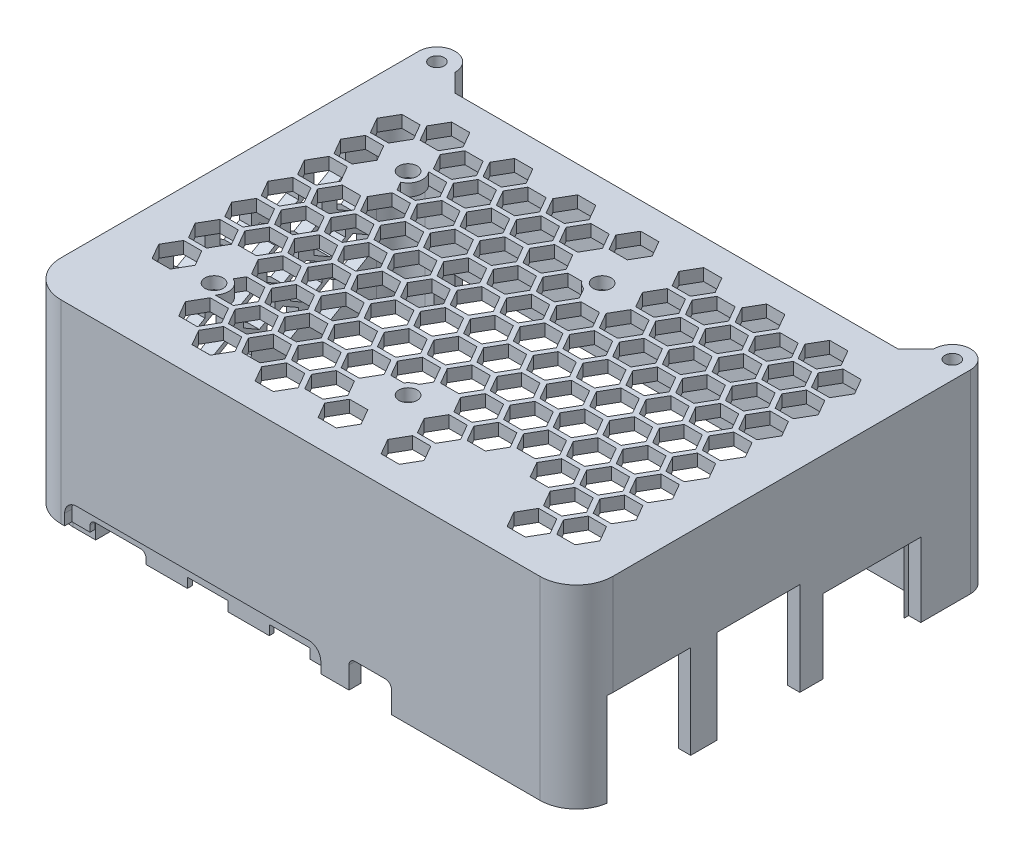
from build123d import *

# Parameters (mm, degrees)
BOSS_EXTRUDE1_DEPTH = 2
BOSS_EXTRUDE2_START = -30
BOSS_EXTRUDE2_DEPTH = 30
BOSS_EXTRUDE3_START = 32
SKETCH12_R          = 1.2
BOSS_EXTRUDE3_DEPTH = 32
BOSS_EXTRUDE4_START = -31.45
SKETCH3_R           = 1.225
BOSS_EXTRUDE4_DEPTH = 31.45
SKETCH5_W           = 2
SKETCH5_H           = 16.1
SKETCH5_H_2         = 13.7
SKETCH5_W_2         = 9.2
SKETCH5_H_3         = 2
SKETCH5_W_3         = 6.7
SKETCH5_W_4         = 7
CUT_EXTRUDE2_DEPTH  = 1.6
CUT_EXTRUDE3_DEPTH  = 0.2
FILLET1_R           = 0.8
SKETCH14_W          = 7
SKETCH14_H          = 2
CUT_EXTRUDE4_DEPTH  = 3
SKETCH15_W          = 2
SKETCH15_H          = 13.7
CUT_EXTRUDE5_DEPTH  = 13.8
CUT_EXTRUDE6_DEPTH  = 10.6
CHAMFER1_SIZE       = 3
CUT_EXTRUDE7_REACH  = 113.055
SKETCH18_W          = 55.5
SKETCH18_H          = 8
FILLET2_R           = 1
CUT_EXTRUDE8_DEPTH  = 1.2
SKETCH23_R          = 1.5
CUT_EXTRUDE11_DEPTH = 115.402371042
FILL_PATTERN1_DEPTH = 2
FILL_START          = -3
FILL_PATTERN5_DEPTH = 2
CUT_EXTRUDE12_REACH = 116.402


# Read off the part's stored shape, not the designer's step: Fill Pattern1, Fill Pattern5
# Some blends are built 0.0001 mm under size
with BuildPart() as part:
    # Sketch1 → Boss-Extrude1 (new body)
    with BuildSketch(Plane(origin=(0, 0, 0), x_dir=(1, 0, 0), z_dir=(0, 1, 0))):
        with BuildLine():
            Line((-3, 3), (-3, 53))
            ThreePointArc((-3, 53), (-1.242640687, 57.242640687), (3, 59))
            Line((3, 59), (82, 59))
            ThreePointArc((82, 59), (86.242640687, 57.242640687), (88, 53))
            Line((88, 53), (88, 3))
            ThreePointArc((88, 3), (86.242640687, -1.242640687), (82, -3))
            Line((82, -3), (3, -3))
            ThreePointArc((3, -3), (-1.242640687, -1.242640687), (-3, 3))
        make_face()
    extrude(amount=BOSS_EXTRUDE1_DEPTH)

    # Sketch2 → Boss-Extrude2 (add)
    with BuildSketch(Plane(origin=(0, 0, 0), x_dir=(1, 0, 0), z_dir=(0, 1, 0)).offset(BOSS_EXTRUDE2_START)):
        with BuildLine():
            Line((3, -3), (82, -3))
            ThreePointArc((82, -3), (86.242640687, -1.242640687), (88, 3))
            Line((88, 3), (88, 53))
            ThreePointArc((88, 53), (86.242640687, 57.242640687), (82, 59))
            Line((82, 59), (3, 59))
            ThreePointArc((3, 59), (-1.242640687, 57.242640687), (-3, 53))
            Line((-3, 53), (-3, 3))
            ThreePointArc((-3, 3), (-1.242640687, -1.242640687), (3, -3))
        make_face()
        with BuildLine():
            Line((82, 57), (3, 57))
            ThreePointArc((3, 57), (0.171572875, 55.828427125), (-1, 53))
            Line((-1, 53), (-1, 3))
            ThreePointArc((-1, 3), (0.171572875, 0.171572875), (3, -1))
            Line((3, -1), (82, -1))
            ThreePointArc((82, -1), (84.828427125, 0.171572875), (86, 3))
            Line((86, 3), (86, 53))
            ThreePointArc((86, 53), (84.828427125, 55.828427125), (82, 57))
        make_face(mode=Mode.SUBTRACT)
    extrude(amount=BOSS_EXTRUDE2_DEPTH)

    # Sketch12 → Boss-Extrude3 (add)
    # profile 1 of 2: a face of its own
    with BuildSketch(Plane.XZ.offset(-2).offset(BOSS_EXTRUDE3_START)):
        with BuildLine():
            Line((88, -59), (88, -62))
            ThreePointArc((88, -62), (85, -65), (82, -62))
            Line((82, -62), (82, -59))
            ThreePointArc((82, -59), (86.242640687, -57.242640687), (88, -53))
            Line((88, -53), (88, -59))
        make_face()
        with Locations(Location((85, -62, 0), (0, 0, 90))):
            Circle(SKETCH12_R, mode=Mode.SUBTRACT)
    # profile 2 of 2: a face of its own
    with BuildSketch(Plane.XZ.offset(-2).offset(BOSS_EXTRUDE3_START)):
        with BuildLine():
            Line((-3, -59), (-3, -62))
            ThreePointArc((-3, -62), (0, -65), (3, -62))
            Line((3, -62), (3, -59))
            ThreePointArc((3, -59), (-1.242640687, -57.242640687), (-3, -53))
            Line((-3, -53), (-3, -59))
        make_face()
        with Locations(Location((0, -62, 0), (0, 0, 90))):
            Circle(SKETCH12_R, mode=Mode.SUBTRACT)
    extrude(amount=-BOSS_EXTRUDE3_DEPTH)

    # Sketch3 → Boss-Extrude4 (add)
    # profile 1 of 2: a face of its own
    with BuildSketch(Plane(origin=(0, 0, 0), x_dir=(1, 0, 0), z_dir=(0, 1, 0)).offset(BOSS_EXTRUDE4_START)):
        with BuildLine():
            Line((6.725, 3.5), (6.725, -1))
            Line((6.725, -1), (3, -1))
            ThreePointArc((3, -1), (0.171572875, 0.171572875), (-1, 3))
            Line((-1, 3), (-1, 6.725))
            Line((-1, 6.725), (3.5, 6.725))
            ThreePointArc((3.5, 6.725), (5.780419369, 5.780419369), (6.725, 3.5))
        make_face()
        with Locations(Location((3.5, 3.5, 0), (0, 0, 270))):
            Circle(SKETCH3_R, mode=Mode.SUBTRACT)
    # profile 2 of 2: a face of its own
    with BuildSketch(Plane(origin=(0, 0, 0), x_dir=(1, 0, 0), z_dir=(0, 1, 0)).offset(BOSS_EXTRUDE4_START)):
        with BuildLine():
            Line((64.725, 3.5), (64.725, -1))
            Line((64.725, -1), (58.275, -1))
            Line((58.275, -1), (58.275, 3.5))
            ThreePointArc((58.275, 3.5), (61.5, 6.725), (64.725, 3.5))
        make_face()
        with Locations(Location((61.5, 3.5, 0), (0, 0, 270))):
            Circle(SKETCH3_R, mode=Mode.SUBTRACT)
    extrude(amount=BOSS_EXTRUDE4_DEPTH)

    # Sketch5 → Cut-Extrude2 (cut)
    with BuildSketch(Plane(origin=(0, -30, 0), x_dir=(1, 0, 0), z_dir=(0, 1, 0))):
        with Locations((87, 45.75)):
            Rectangle(SKETCH5_W, SKETCH5_H)
        with Locations((87, 27)):
            Rectangle(SKETCH5_W, SKETCH5_H_2)
        with Locations((87, 9)):
            Rectangle(SKETCH5_W, SKETCH5_H_2)
        with Locations((11.2, -2)):
            Rectangle(SKETCH5_W_2, SKETCH5_H_3)
        with Locations((26, -2)):
            Rectangle(SKETCH5_W_3, SKETCH5_H_3)
        with Locations((39.5, -2)):
            Rectangle(SKETCH5_W_3, SKETCH5_H_3)
        with Locations((54, -2)):
            Rectangle(SKETCH5_W_4, SKETCH5_H_3)
    extrude(amount=CUT_EXTRUDE2_DEPTH, mode=Mode.SUBTRACT)

    # Sketch13 → Cut-Extrude3 (cut)
    with BuildSketch(Plane.XZ.offset(28.4)):
        Polygon((6.6, 3), (6.6, 1), (6.725, 1), (15.8, 1), (15.8, 3), align=None)
    extrude(amount=-CUT_EXTRUDE3_DEPTH, mode=Mode.SUBTRACT)

    # Fillet1
    # the kernel refuses this fillet: 0.8 mm, written as the material it adds along each edge
    with BuildSketch(Plane(origin=(15.8, -28.2, 1), x_dir=(0, -1, 0), z_dir=(0, 0, 1))) as fillet1_piece_1:
        with BuildLine():
            CenterArc((FILLET1_R, -FILLET1_R), FILLET1_R, 90, 90)
            Line((0, -FILLET1_R), (0, 0))
            Line((0, 0), (FILLET1_R, 0))
        make_face()
    extrude(amount=2)
    with BuildSketch(Plane(origin=(6.6, -28.2, 3), x_dir=(1, 0, 0), z_dir=(0, 0, -1))) as fillet1_piece_2:
        with BuildLine():
            CenterArc((FILLET1_R, FILLET1_R), FILLET1_R, 180, 90)
            Line((0, FILLET1_R), (0, 0))
            Line((0, 0), (FILLET1_R, 0))
        make_face()
    extrude(amount=2)

    # Sketch14 → Cut-Extrude4 (cut)
    with BuildSketch(Plane.XZ.offset(28.4)):
        with Locations((54, 2)):
            Rectangle(SKETCH14_W, SKETCH14_H)
    extrude(amount=-CUT_EXTRUDE4_DEPTH, mode=Mode.SUBTRACT)

    # Sketch15 → Cut-Extrude5 (cut)
    with BuildSketch(Plane.XZ.offset(28.4)):
        with Locations((87, -27)):
            Rectangle(SKETCH15_W, SKETCH15_H)
        with BuildLine():
            Line((87.93948651, -2.15), (86, -2.15))
            Line((86, -2.15), (86, -3))
            Line((86, -3), (86, -15.85))
            Line((86, -15.85), (88, -15.85))
            Line((88, -15.85), (88, -3))
            ThreePointArc((88, -3), (87.984852507, -2.573924337), (87.93948651, -2.15))
        make_face()
    extrude(amount=-CUT_EXTRUDE5_DEPTH, mode=Mode.SUBTRACT)

    # Sketch16 → Cut-Extrude6 (cut)
    with BuildSketch(Plane.XZ.offset(28.4)):
        Polygon((86, -53), (86, -53.8), (88, -53.8), (88, -37.7), (86, -37.7), align=None)
    extrude(amount=-CUT_EXTRUDE6_DEPTH, mode=Mode.SUBTRACT)

    # Chamfer1
    chamfer1_edges = [part.edges().sort_by_distance(p)[0] for p in [
        (3, -14, -59),
        (82, -14, -59),
    ]]
    chamfer(chamfer1_edges, length=CHAMFER1_SIZE - 0.0001)  # a hair under: the kernel refuses the full size

    # Sketch18 → Cut-Extrude7 (cut, up to next)
    with BuildSketch(Plane.XY.offset(-57), mode=Mode.PRIVATE) as cut_extrude7_sk1:
        with Locations((32.25, -26)):
            Rectangle(SKETCH18_W, SKETCH18_H)
    cut_extrude7_tool1 = extrude(cut_extrude7_sk1.sketch, amount=-CUT_EXTRUDE7_REACH, mode=Mode.PRIVATE) & part.part
    add(cut_extrude7_tool1.solids().sort_by_distance((32.25, -26, -57))[0], mode=Mode.SUBTRACT)

    # Fillet2
    fillet2_edges = [part.edges().sort_by_distance(p)[0] for p in [
        (57.5, -25.4, 2),
        (50.5, -25.4, 2),
    ]]
    fillet(fillet2_edges, radius=FILLET2_R)

    # Sketch19 → Cut-Extrude8 (cut)
    with BuildSketch(Plane.XY.offset(3)):
        with BuildLine():
            Line((5.6, -26.2), (43.85, -26.2))
            ThreePointArc((43.85, -26.2), (45.264213562, -26.785786438), (45.85, -28.2))
            Line((45.85, -28.2), (45.85, -30))
            Line((45.85, -30), (3.6, -30))
            Line((3.6, -30), (3.6, -28.2))
            ThreePointArc((3.6, -28.2), (4.185786438, -26.785786438), (5.6, -26.2))
        make_face()
    extrude(amount=-CUT_EXTRUDE8_DEPTH, mode=Mode.SUBTRACT)

    # Sketch23 → Cut-Extrude11 (cut, through all)
    with BuildSketch(Plane(origin=(0, 2, 0), x_dir=(1, 0, 0), z_dir=(0, 1, 0))):
        with Locations(Location((13.24, 44, 0), (0, 0, 270))):
            Circle(SKETCH23_R)
        with Locations(Location((45.24, 44, 0), (0, 0, 270))):
            Circle(SKETCH23_R)
        with Locations(Location((45.24, 12, 0), (0, 0, 270))):
            Circle(SKETCH23_R)
        with Locations(Location((13.24, 12, 0), (0, 0, 270))):
            Circle(SKETCH23_R)
    extrude(amount=-CUT_EXTRUDE11_DEPTH, mode=Mode.SUBTRACT)

    # Fill Pattern1 outline → Fill Pattern1 (cut)
    with BuildSketch(Plane(origin=(0, 0, 0), x_dir=(1, 0, 0), z_dir=(0, 1, 0))):
        Polygon((20.215390309, 6.598076211), (18.715390309, 4), (20.215390309, 1.401923789), (23.215390309, 1.401923789), (24.715390309, 4), (23.215390309, 6.598076211), align=None)
        Polygon((35.803847577, 33.598076211), (34.303847577, 31), (35.803847577, 28.401923789), (38.803847577, 28.401923789), (40.303847577, 31), (38.803847577, 33.598076211), align=None)
        Polygon((25.411542732, 15.598076211), (23.911542732, 13), (25.411542732, 10.401923789), (28.411542732, 10.401923789), (29.911542732, 13), (28.411542732, 15.598076211), align=None)
        Polygon((30.607695155, 24.598076211), (29.107695155, 22), (30.607695155, 19.401923789), (33.607695155, 19.401923789), (35.107695155, 22), (33.607695155, 24.598076211), align=None)
        Polygon((33.607695155, 6.598076211), (30.607695155, 6.598076211), (29.107695155, 4), (30.607695155, 1.401923789), (33.607695155, 1.401923789), (35.107695155, 4), align=None)
        Polygon((44, 6.598076211), (41, 6.598076211), (39.5, 4), (41, 1.401923789), (44, 1.401923789), (45.5, 4), align=None)
        Polygon((54.392304845, 6.598076211), (51.392304845, 6.598076211), (49.892304845, 4), (51.392304845, 1.401923789), (54.392304845, 1.401923789), (55.892304845, 4), align=None)
        Polygon((75.176914536, 6.598076211), (72.176914536, 6.598076211), (70.676914536, 4), (72.176914536, 1.401923789), (75.176914536, 1.401923789), (76.676914536, 4), align=None)
        Polygon((9.126933041, 31), (7.626933041, 33.598076211), (4.626933041, 33.598076211), (3.126933041, 31), (4.626933041, 28.401923789), (7.626933041, 28.401923789), align=None)
        Polygon((14.323085464, 22), (12.823085464, 24.598076211), (9.823085464, 24.598076211), (8.323085464, 22), (9.823085464, 19.401923789), (12.823085464, 19.401923789), align=None)
        Polygon((4.626933041, 39.598076211), (3.126933041, 37), (4.626933041, 34.401923789), (7.626933041, 34.401923789), (9.126933041, 37), (7.626933041, 39.598076211), align=None)
        Polygon((18.019237886, 39.598076211), (15.019237886, 39.598076211), (13.519237886, 37), (15.019237886, 34.401923789), (18.019237886, 34.401923789), (19.519237886, 37), align=None)
        Polygon((38.803847577, 39.598076211), (35.803847577, 39.598076211), (34.303847577, 37), (35.803847577, 34.401923789), (38.803847577, 34.401923789), (40.303847577, 37), align=None)
        Polygon((49.196152423, 39.598076211), (46.196152423, 39.598076211), (44.696152423, 37), (46.196152423, 34.401923789), (49.196152423, 34.401923789), (50.696152423, 37), align=None)
        Polygon((28.411542732, 39.598076211), (25.411542732, 39.598076211), (23.911542732, 37), (25.411542732, 34.401923789), (28.411542732, 34.401923789), (29.911542732, 37), align=None)
        Polygon((80.373066959, 39.598076211), (77.373066959, 39.598076211), (75.873066959, 37), (77.373066959, 34.401923789), (80.373066959, 34.401923789), (81.873066959, 37), align=None)
        Polygon((59.588457268, 39.598076211), (56.588457268, 39.598076211), (55.088457268, 37), (56.588457268, 34.401923789), (59.588457268, 34.401923789), (61.088457268, 37), align=None)
        Polygon((69.980762114, 39.598076211), (66.980762114, 39.598076211), (65.480762114, 37), (66.980762114, 34.401923789), (69.980762114, 34.401923789), (71.480762114, 37), align=None)
        Polygon((14.323085464, 28), (12.823085464, 30.598076211), (9.823085464, 30.598076211), (8.323085464, 28), (9.823085464, 25.401923789), (12.823085464, 25.401923789), align=None)
        Polygon((24.715390309, 10), (23.215390309, 12.598076211), (20.215390309, 12.598076211), (18.715390309, 10), (20.215390309, 7.401923789), (23.215390309, 7.401923789), align=None)
        Polygon((19.519237886, 19), (18.019237886, 21.598076211), (15.019237886, 21.598076211), (13.519237886, 19), (15.019237886, 16.401923789), (18.019237886, 16.401923789), align=None)
        Polygon((15.019237886, 51.598076211), (13.519237886, 49), (15.019237886, 46.401923789), (18.019237886, 46.401923789), (19.519237886, 49), (18.019237886, 51.598076211), align=None)
        Polygon((28.411542732, 33.598076211), (25.411542732, 33.598076211), (23.911542732, 31), (25.411542732, 28.401923789), (28.411542732, 28.401923789), (29.911542732, 31), align=None)
        Polygon((49.196152423, 33.598076211), (46.196152423, 33.598076211), (44.696152423, 31), (46.196152423, 28.401923789), (49.196152423, 28.401923789), (50.696152423, 31), align=None)
        Polygon((18.019237886, 33.598076211), (15.019237886, 33.598076211), (13.519237886, 31), (15.019237886, 28.401923789), (18.019237886, 28.401923789), (19.519237886, 31), align=None)
        Polygon((80.373066959, 33.598076211), (77.373066959, 33.598076211), (75.873066959, 31), (77.373066959, 28.401923789), (80.373066959, 28.401923789), (81.873066959, 31), align=None)
        Polygon((59.588457268, 33.598076211), (56.588457268, 33.598076211), (55.088457268, 31), (56.588457268, 28.401923789), (59.588457268, 28.401923789), (61.088457268, 31), align=None)
        Polygon((69.980762114, 33.598076211), (66.980762114, 33.598076211), (65.480762114, 31), (66.980762114, 28.401923789), (69.980762114, 28.401923789), (71.480762114, 31), align=None)
        Polygon((41, 54.598076211), (39.5, 52), (41, 49.401923789), (44, 49.401923789), (45.5, 52), (44, 54.598076211), align=None)
        Polygon((30.607695155, 36.598076211), (29.107695155, 34), (30.607695155, 31.401923789), (33.607695155, 31.401923789), (35.107695155, 34), (33.607695155, 36.598076211), align=None)
        Polygon((35.803847577, 45.598076211), (34.303847577, 43), (35.803847577, 40.401923789), (38.803847577, 40.401923789), (40.303847577, 43), (38.803847577, 45.598076211), align=None)
        Polygon((15.019237886, 9.598076211), (13.519237886, 7), (15.019237886, 4.401923789), (18.019237886, 4.401923789), (19.519237886, 7), (18.019237886, 9.598076211), align=None)
        Polygon((25.411542732, 27.598076211), (23.911542732, 25), (25.411542732, 22.401923789), (28.411542732, 22.401923789), (29.911542732, 25), (28.411542732, 27.598076211), align=None)
        Polygon((20.215390309, 18.598076211), (18.715390309, 16), (20.215390309, 13.401923789), (23.215390309, 13.401923789), (24.715390309, 16), (23.215390309, 18.598076211), align=None)
        Polygon((33.607695155, 54.598076211), (30.607695155, 54.598076211), (29.107695155, 52), (30.607695155, 49.401923789), (33.607695155, 49.401923789), (35.107695155, 52), align=None)
        Polygon((54.392304845, 54.598076211), (51.392304845, 54.598076211), (49.892304845, 52), (51.392304845, 49.401923789), (54.392304845, 49.401923789), (55.892304845, 52), align=None)
        Polygon((12.823085464, 54.598076211), (9.823085464, 54.598076211), (8.323085464, 52), (9.823085464, 49.401923789), (12.823085464, 49.401923789), (14.323085464, 52), align=None)
        Polygon((23.215390309, 54.598076211), (20.215390309, 54.598076211), (18.715390309, 52), (20.215390309, 49.401923789), (23.215390309, 49.401923789), (24.715390309, 52), align=None)
        Polygon((75.176914536, 54.598076211), (72.176914536, 54.598076211), (70.676914536, 52), (72.176914536, 49.401923789), (75.176914536, 49.401923789), (76.676914536, 52), align=None)
        Polygon((64.784609691, 54.598076211), (61.784609691, 54.598076211), (60.284609691, 52), (61.784609691, 49.401923789), (64.784609691, 49.401923789), (66.284609691, 52), align=None)
        Polygon((55.892304845, 34), (54.392304845, 36.598076211), (51.392304845, 36.598076211), (49.892304845, 34), (51.392304845, 31.401923789), (54.392304845, 31.401923789), align=None)
        Polygon((61.088457268, 25), (59.588457268, 27.598076211), (56.588457268, 27.598076211), (55.088457268, 25), (56.588457268, 22.401923789), (59.588457268, 22.401923789), align=None)
        Polygon((66.284609691, 16), (64.784609691, 18.598076211), (61.784609691, 18.598076211), (60.284609691, 16), (61.784609691, 13.401923789), (64.784609691, 13.401923789), align=None)
        Polygon((20.215390309, 36.598076211), (18.715390309, 34), (20.215390309, 31.401923789), (23.215390309, 31.401923789), (24.715390309, 34), (23.215390309, 36.598076211), align=None)
        Polygon((15.019237886, 27.598076211), (13.519237886, 25), (15.019237886, 22.401923789), (18.019237886, 22.401923789), (19.519237886, 25), (18.019237886, 27.598076211), align=None)
        Polygon((25.411542732, 45.598076211), (23.911542732, 43), (25.411542732, 40.401923789), (28.411542732, 40.401923789), (29.911542732, 43), (28.411542732, 45.598076211), align=None)
        Polygon((45.5, 34), (44, 36.598076211), (41, 36.598076211), (39.5, 34), (41, 31.401923789), (44, 31.401923789), align=None)
        Polygon((50.696152423, 25), (49.196152423, 27.598076211), (46.196152423, 27.598076211), (44.696152423, 25), (46.196152423, 22.401923789), (49.196152423, 22.401923789), align=None)
        Polygon((55.892304845, 16), (54.392304845, 18.598076211), (51.392304845, 18.598076211), (49.892304845, 16), (51.392304845, 13.401923789), (54.392304845, 13.401923789), align=None)
        Polygon((25.411542732, 9.598076211), (23.911542732, 7), (25.411542732, 4.401923789), (28.411542732, 4.401923789), (29.911542732, 7), (28.411542732, 9.598076211), align=None)
        Polygon((35.803847577, 27.598076211), (34.303847577, 25), (35.803847577, 22.401923789), (38.803847577, 22.401923789), (40.303847577, 25), (38.803847577, 27.598076211), align=None)
        Polygon((30.607695155, 18.598076211), (29.107695155, 16), (30.607695155, 13.401923789), (33.607695155, 13.401923789), (35.107695155, 16), (33.607695155, 18.598076211), align=None)
        Polygon((12.823085464, 36.598076211), (9.823085464, 36.598076211), (8.323085464, 34), (9.823085464, 31.401923789), (12.823085464, 31.401923789), (14.323085464, 34), align=None)
        Polygon((75.176914536, 36.598076211), (72.176914536, 36.598076211), (70.676914536, 34), (72.176914536, 31.401923789), (75.176914536, 31.401923789), (76.676914536, 34), align=None)
        Polygon((64.784609691, 36.598076211), (61.784609691, 36.598076211), (60.284609691, 34), (61.784609691, 31.401923789), (64.784609691, 31.401923789), (66.284609691, 34), align=None)
        Polygon((41, 30.598076211), (39.5, 28), (41, 25.401923789), (44, 25.401923789), (45.5, 28), (44, 30.598076211), align=None)
        Polygon((51.392304845, 48.598076211), (49.892304845, 46), (51.392304845, 43.401923789), (54.392304845, 43.401923789), (55.892304845, 46), (54.392304845, 48.598076211), align=None)
        Polygon((35.803847577, 21.598076211), (34.303847577, 19), (35.803847577, 16.401923789), (38.803847577, 16.401923789), (40.303847577, 19), (38.803847577, 21.598076211), align=None)
        Polygon((30.607695155, 12.598076211), (29.107695155, 10), (30.607695155, 7.401923789), (33.607695155, 7.401923789), (35.107695155, 10), (33.607695155, 12.598076211), align=None)
        Polygon((54.392304845, 30.598076211), (51.392304845, 30.598076211), (49.892304845, 28), (51.392304845, 25.401923789), (54.392304845, 25.401923789), (55.892304845, 28), align=None)
        Polygon((33.607695155, 30.598076211), (30.607695155, 30.598076211), (29.107695155, 28), (30.607695155, 25.401923789), (33.607695155, 25.401923789), (35.107695155, 28), align=None)
        Polygon((75.176914536, 30.598076211), (72.176914536, 30.598076211), (70.676914536, 28), (72.176914536, 25.401923789), (75.176914536, 25.401923789), (76.676914536, 28), align=None)
        Polygon((23.215390309, 30.598076211), (20.215390309, 30.598076211), (18.715390309, 28), (20.215390309, 25.401923789), (23.215390309, 25.401923789), (24.715390309, 28), align=None)
        Polygon((64.784609691, 30.598076211), (61.784609691, 30.598076211), (60.284609691, 28), (61.784609691, 25.401923789), (64.784609691, 25.401923789), (66.284609691, 28), align=None)
        Polygon((35.107695155, 46), (33.607695155, 48.598076211), (30.607695155, 48.598076211), (29.107695155, 46), (30.607695155, 43.401923789), (33.607695155, 43.401923789), align=None)
        Polygon((55.892304845, 10), (54.392304845, 12.598076211), (51.392304845, 12.598076211), (49.892304845, 10), (51.392304845, 7.401923789), (54.392304845, 7.401923789), align=None)
        Polygon((50.696152423, 19), (49.196152423, 21.598076211), (46.196152423, 21.598076211), (44.696152423, 19), (46.196152423, 16.401923789), (49.196152423, 16.401923789), align=None)
        Polygon((30.607695155, 42.598076211), (29.107695155, 40), (30.607695155, 37.401923789), (33.607695155, 37.401923789), (35.107695155, 40), (33.607695155, 42.598076211), align=None)
        Polygon((35.803847577, 51.598076211), (34.303847577, 49), (35.803847577, 46.401923789), (38.803847577, 46.401923789), (40.303847577, 49), (38.803847577, 51.598076211), align=None)
        Polygon((20.215390309, 24.598076211), (18.715390309, 22), (20.215390309, 19.401923789), (23.215390309, 19.401923789), (24.715390309, 22), (23.215390309, 24.598076211), align=None)
        Polygon((24.715390309, 40), (23.215390309, 42.598076211), (20.215390309, 42.598076211), (18.715390309, 40), (20.215390309, 37.401923789), (23.215390309, 37.401923789), align=None)
        Polygon((40.303847577, 13), (38.803847577, 15.598076211), (35.803847577, 15.598076211), (34.303847577, 13), (35.803847577, 10.401923789), (38.803847577, 10.401923789), align=None)
        Polygon((4.626933041, 27.598076211), (3.126933041, 25), (4.626933041, 22.401923789), (7.626933041, 22.401923789), (9.126933041, 25), (7.626933041, 27.598076211), align=None)
        Polygon((9.126933041, 43), (7.626933041, 45.598076211), (4.626933041, 45.598076211), (3.126933041, 43), (4.626933041, 40.401923789), (7.626933041, 40.401923789), align=None)
        Polygon((20.215390309, 48.598076211), (18.715390309, 46), (20.215390309, 43.401923789), (23.215390309, 43.401923789), (24.715390309, 46), (23.215390309, 48.598076211), align=None)
        Polygon((4.626933041, 21.598076211), (3.126933041, 19), (4.626933041, 16.401923789), (7.626933041, 16.401923789), (9.126933041, 19), (7.626933041, 21.598076211), align=None)
        Polygon((29.911542732, 19), (28.411542732, 21.598076211), (25.411542732, 21.598076211), (23.911542732, 19), (25.411542732, 16.401923789), (28.411542732, 16.401923789), align=None)
        Polygon((54.392304845, 42.598076211), (51.392304845, 42.598076211), (49.892304845, 40), (51.392304845, 37.401923789), (54.392304845, 37.401923789), (55.892304845, 40), align=None)
        Polygon((75.176914536, 42.598076211), (72.176914536, 42.598076211), (70.676914536, 40), (72.176914536, 37.401923789), (75.176914536, 37.401923789), (76.676914536, 40), align=None)
        Polygon((64.784609691, 42.598076211), (61.784609691, 42.598076211), (60.284609691, 40), (61.784609691, 37.401923789), (64.784609691, 37.401923789), (66.284609691, 40), align=None)
        Polygon((29.911542732, 49), (28.411542732, 51.598076211), (25.411542732, 51.598076211), (23.911542732, 49), (25.411542732, 46.401923789), (28.411542732, 46.401923789), align=None)
        Polygon((45.5, 22), (44, 24.598076211), (41, 24.598076211), (39.5, 22), (41, 19.401923789), (44, 19.401923789), align=None)
        Polygon((75.176914536, 48.598076211), (72.176914536, 48.598076211), (70.676914536, 46), (72.176914536, 43.401923789), (75.176914536, 43.401923789), (76.676914536, 46), align=None)
        Polygon((64.784609691, 48.598076211), (61.784609691, 48.598076211), (60.284609691, 46), (61.784609691, 43.401923789), (64.784609691, 43.401923789), (66.284609691, 46), align=None)
        Polygon((40.303847577, 7), (38.803847577, 9.598076211), (35.803847577, 9.598076211), (34.303847577, 7), (35.803847577, 4.401923789), (38.803847577, 4.401923789), align=None)
        Polygon((80.373066959, 45.598076211), (77.373066959, 45.598076211), (75.873066959, 43), (77.373066959, 40.401923789), (80.373066959, 40.401923789), (81.873066959, 43), align=None)
        Polygon((59.588457268, 45.598076211), (56.588457268, 45.598076211), (55.088457268, 43), (56.588457268, 40.401923789), (59.588457268, 40.401923789), (61.088457268, 43), align=None)
        Polygon((69.980762114, 45.598076211), (66.980762114, 45.598076211), (65.480762114, 43), (66.980762114, 40.401923789), (69.980762114, 40.401923789), (71.480762114, 43), align=None)
        Polygon((4.626933041, 15.598076211), (3.126933041, 13), (4.626933041, 10.401923789), (7.626933041, 10.401923789), (9.126933041, 13), (7.626933041, 15.598076211), align=None)
        Polygon((54.392304845, 24.598076211), (51.392304845, 24.598076211), (49.892304845, 22), (51.392304845, 19.401923789), (54.392304845, 19.401923789), (55.892304845, 22), align=None)
        Polygon((75.176914536, 24.598076211), (72.176914536, 24.598076211), (70.676914536, 22), (72.176914536, 19.401923789), (75.176914536, 19.401923789), (76.676914536, 22), align=None)
        Polygon((64.784609691, 24.598076211), (61.784609691, 24.598076211), (60.284609691, 22), (61.784609691, 19.401923789), (64.784609691, 19.401923789), (66.284609691, 22), align=None)
        Polygon((80.373066959, 27.598076211), (77.373066959, 27.598076211), (75.873066959, 25), (77.373066959, 22.401923789), (80.373066959, 22.401923789), (81.873066959, 25), align=None)
        Polygon((69.980762114, 27.598076211), (66.980762114, 27.598076211), (65.480762114, 25), (66.980762114, 22.401923789), (69.980762114, 22.401923789), (71.480762114, 25), align=None)
        Polygon((76.676914536, 16), (75.176914536, 18.598076211), (72.176914536, 18.598076211), (70.676914536, 16), (72.176914536, 13.401923789), (75.176914536, 13.401923789), align=None)
        Polygon((81.873066959, 7), (80.373066959, 9.598076211), (77.373066959, 9.598076211), (75.873066959, 7), (77.373066959, 4.401923789), (80.373066959, 4.401923789), align=None)
        Polygon((76.676914536, 10), (75.176914536, 12.598076211), (72.176914536, 12.598076211), (70.676914536, 10), (72.176914536, 7.401923789), (75.176914536, 7.401923789), align=None)
        Polygon((71.480762114, 19), (69.980762114, 21.598076211), (66.980762114, 21.598076211), (65.480762114, 19), (66.980762114, 16.401923789), (69.980762114, 16.401923789), align=None)
        Polygon((56.588457268, 51.598076211), (55.088457268, 49), (56.588457268, 46.401923789), (59.588457268, 46.401923789), (61.088457268, 49), (59.588457268, 51.598076211), align=None)
        Polygon((71.480762114, 13), (69.980762114, 15.598076211), (66.980762114, 15.598076211), (65.480762114, 13), (66.980762114, 10.401923789), (69.980762114, 10.401923789), align=None)
        Polygon((61.088457268, 19), (59.588457268, 21.598076211), (56.588457268, 21.598076211), (55.088457268, 19), (56.588457268, 16.401923789), (59.588457268, 16.401923789), align=None)
        Polygon((66.980762114, 51.598076211), (65.480762114, 49), (66.980762114, 46.401923789), (69.980762114, 46.401923789), (71.480762114, 49), (69.980762114, 51.598076211), align=None)
        Polygon((61.088457268, 13), (59.588457268, 15.598076211), (56.588457268, 15.598076211), (55.088457268, 13), (56.588457268, 10.401923789), (59.588457268, 10.401923789), align=None)
        Polygon((7.626933041, 51.598076211), (4.626933041, 51.598076211), (3.126933041, 49), (4.626933041, 46.401923789), (7.626933041, 46.401923789), (9.126933041, 49), align=None)
        Polygon((80.373066959, 51.598076211), (77.373066959, 51.598076211), (75.873066959, 49), (77.373066959, 46.401923789), (80.373066959, 46.401923789), (81.873066959, 49), align=None)
        Polygon((81.873066959, 13), (80.373066959, 15.598076211), (77.373066959, 15.598076211), (75.873066959, 13), (77.373066959, 10.401923789), (80.373066959, 10.401923789), align=None)
        Polygon((77.373066959, 21.598076211), (75.873066959, 19), (77.373066959, 16.401923789), (80.373066959, 16.401923789), (81.873066959, 19), (80.373066959, 21.598076211), align=None)
    extrude(amount=FILL_PATTERN1_DEPTH, mode=Mode.SUBTRACT)

    # Fill Pattern5 outline → Fill Pattern5 (cut)
    with BuildSketch(Plane.YZ.offset(FILL_START)):
        Polygon((-21.096266659, -46.548052079), (-22.596266659, -49.146128291), (-21.096266659, -51.744204502), (-18.096266659, -51.744204502), (-16.596266659, -49.146128291), (-18.096266659, -46.548052079), align=None)
        Polygon((-11.903733341, -51.744204502), (-8.903733341, -51.744204502), (-7.403733341, -49.146128291), (-8.903733341, -46.548052079), (-11.903733341, -46.548052079), (-13.403733341, -49.146128291), align=None)
        Polygon((-21.096266659, -23.407698131), (-22.596266659, -26.005774342), (-21.096266659, -28.603850553), (-18.096266659, -28.603850553), (-16.596266659, -26.005774342), (-18.096266659, -23.407698131), align=None)
        Polygon((-11.903733341, -28.603850553), (-8.903733341, -28.603850553), (-7.403733341, -26.005774342), (-8.903733341, -23.407698131), (-11.903733341, -23.407698131), (-13.403733341, -26.005774342), align=None)
        Polygon((-21.096266659, -15.694246814), (-22.596266659, -18.292323026), (-21.096266659, -20.890399237), (-18.096266659, -20.890399237), (-16.596266659, -18.292323026), (-18.096266659, -15.694246814), align=None)
        Polygon((-11.903733341, -20.890399237), (-8.903733341, -20.890399237), (-7.403733341, -18.292323026), (-8.903733341, -15.694246814), (-11.903733341, -15.694246814), (-13.403733341, -18.292323026), align=None)
        Polygon((-21.096266659, -7.980795498), (-22.596266659, -10.578871709), (-21.096266659, -13.176947921), (-18.096266659, -13.176947921), (-16.596266659, -10.578871709), (-18.096266659, -7.980795498), align=None)
        Polygon((-11.903733341, -13.176947921), (-8.903733341, -13.176947921), (-7.403733341, -10.578871709), (-8.903733341, -7.980795498), (-11.903733341, -7.980795498), (-13.403733341, -10.578871709), align=None)
        Polygon((-25.692533317, -27.264423789), (-27.192533317, -29.8625), (-25.692533317, -32.460576211), (-22.692533317, -32.460576211), (-21.192533317, -29.8625), (-22.692533317, -27.264423789), align=None)
        Polygon((-7.307466683, -32.460576211), (-4.307466683, -32.460576211), (-2.807466683, -29.8625), (-4.307466683, -27.264423789), (-7.307466683, -27.264423789), (-8.807466683, -29.8625), align=None)
        Polygon((-16.5, -32.460576211), (-13.5, -32.460576211), (-12, -29.8625), (-13.5, -27.264423789), (-16.5, -27.264423789), (-18, -29.8625), align=None)
        Polygon((-25.692533317, -34.977875105), (-27.192533317, -37.575951316), (-25.692533317, -40.174027528), (-22.692533317, -40.174027528), (-21.192533317, -37.575951316), (-22.692533317, -34.977875105), align=None)
        Polygon((-7.307466683, -40.174027528), (-4.307466683, -40.174027528), (-2.807466683, -37.575951316), (-4.307466683, -34.977875105), (-7.307466683, -34.977875105), (-8.807466683, -37.575951316), align=None)
        Polygon((-16.5, -40.174027528), (-13.5, -40.174027528), (-12, -37.575951316), (-13.5, -34.977875105), (-16.5, -34.977875105), (-18, -37.575951316), align=None)
        Polygon((-21.096266659, -31.121149447), (-22.596266659, -33.719225658), (-21.096266659, -36.317301869), (-18.096266659, -36.317301869), (-16.596266659, -33.719225658), (-18.096266659, -31.121149447), align=None)
        Polygon((-11.903733341, -36.317301869), (-8.903733341, -36.317301869), (-7.403733341, -33.719225658), (-8.903733341, -31.121149447), (-11.903733341, -31.121149447), (-13.403733341, -33.719225658), align=None)
        Polygon((-16.5, -11.837521156), (-18, -14.435597368), (-16.5, -17.033673579), (-13.5, -17.033673579), (-12, -14.435597368), (-13.5, -11.837521156), align=None)
        Polygon((-25.692533317, -17.033673579), (-22.692533317, -17.033673579), (-21.192533317, -14.435597368), (-22.692533317, -11.837521156), (-25.692533317, -11.837521156), (-27.192533317, -14.435597368), align=None)
        Polygon((-7.307466683, -17.033673579), (-4.307466683, -17.033673579), (-2.807466683, -14.435597368), (-4.307466683, -11.837521156), (-7.307466683, -11.837521156), (-8.807466683, -14.435597368), align=None)
        Polygon((-16.5, -19.550972472), (-18, -22.149048684), (-16.5, -24.747124895), (-13.5, -24.747124895), (-12, -22.149048684), (-13.5, -19.550972472), align=None)
        Polygon((-25.692533317, -24.747124895), (-22.692533317, -24.747124895), (-21.192533317, -22.149048684), (-22.692533317, -19.550972472), (-25.692533317, -19.550972472), (-27.192533317, -22.149048684), align=None)
        Polygon((-7.307466683, -24.747124895), (-4.307466683, -24.747124895), (-2.807466683, -22.149048684), (-4.307466683, -19.550972472), (-7.307466683, -19.550972472), (-8.807466683, -22.149048684), align=None)
        Polygon((-16.5, -42.691326421), (-18, -45.289402632), (-16.5, -47.887478844), (-13.5, -47.887478844), (-12, -45.289402632), (-13.5, -42.691326421), align=None)
        Polygon((-25.692533317, -47.887478844), (-22.692533317, -47.887478844), (-21.192533317, -45.289402632), (-22.692533317, -42.691326421), (-25.692533317, -42.691326421), (-27.192533317, -45.289402632), align=None)
        Polygon((-7.307466683, -47.887478844), (-4.307466683, -47.887478844), (-2.807466683, -45.289402632), (-4.307466683, -42.691326421), (-7.307466683, -42.691326421), (-8.807466683, -45.289402632), align=None)
        Polygon((-21.096266659, -38.834600763), (-22.596266659, -41.432676974), (-21.096266659, -44.030753186), (-18.096266659, -44.030753186), (-16.596266659, -41.432676974), (-18.096266659, -38.834600763), align=None)
        Polygon((-11.903733341, -44.030753186), (-8.903733341, -44.030753186), (-7.403733341, -41.432676974), (-8.903733341, -38.834600763), (-11.903733341, -38.834600763), (-13.403733341, -41.432676974), align=None)
    extrude(amount=FILL_PATTERN5_DEPTH, mode=Mode.SUBTRACT)

    # Sketch26 → Cut-Extrude12 (cut, up to next)
    with BuildSketch(Plane(origin=(0, 2, 0), x_dir=(1, 0, 0), z_dir=(0, 1, 0)), mode=Mode.PRIVATE) as cut_extrude12_sk1:
        with BuildLine():
            Line((18.023680686, 45.598076211), (19.523680686, 43))
            Line((19.523680686, 43), (18.023680686, 40.401923789))
            Line((18.023680686, 40.401923789), (15.023680686, 40.401923789))
            Line((15.023680686, 40.401923789), (14.210407609, 41.810554079))
            ThreePointArc((14.210407609, 41.810554079), (15.581491311, 43.497224893), (15.023680686, 45.598076211))
            Line((15.023680686, 45.598076211), (18.023680686, 45.598076211))
        make_face()
    cut_extrude12_tool1 = extrude(cut_extrude12_sk1.sketch, amount=-CUT_EXTRUDE12_REACH, mode=Mode.PRIVATE) & part.part
    # Sketch26 → Cut-Extrude12 (cut, up to next)
    with BuildSketch(Plane(origin=(0, 2, 0), x_dir=(1, 0, 0), z_dir=(0, 1, 0)), mode=Mode.PRIVATE) as cut_extrude12_sk2:
        with BuildLine():
            Line((15.017016487, 15.601923789), (18.021459286, 15.601923789))
            Line((18.021459286, 15.601923789), (19.523680686, 13))
            Line((19.523680686, 13), (18.021459286, 10.398076211))
            Line((18.021459286, 10.398076211), (15.021459286, 10.398076211))
            ThreePointArc((15.021459286, 10.398076211), (15.582041442, 12.504577938), (14.203787427, 14.193369738))
            Line((14.203787427, 14.193369738), (15.017016487, 15.601923789))
        make_face()
    cut_extrude12_tool2 = extrude(cut_extrude12_sk2.sketch, amount=-CUT_EXTRUDE12_REACH, mode=Mode.PRIVATE) & part.part
    # Sketch26 → Cut-Extrude12 (cut, up to next)
    with BuildSketch(Plane(origin=(0, 2, 0), x_dir=(1, 0, 0), z_dir=(0, 1, 0)), mode=Mode.PRIVATE) as cut_extrude12_sk3:
        with BuildLine():
            Line((40.9955572, 13.401923789), (39.4955572, 16))
            Line((39.4955572, 16), (40.9955572, 18.598076211))
            Line((40.9955572, 18.598076211), (43.9955572, 18.598076211))
            Line((43.9955572, 18.598076211), (45.4955572, 16))
            Line((45.4955572, 16), (44.594070849, 14.438579837))
            ThreePointArc((44.594070849, 14.438579837), (43.773733424, 14.052792833), (43.142738505, 13.401923789))
            Line((43.142738505, 13.401923789), (40.9955572, 13.401923789))
        make_face()
    cut_extrude12_tool3 = extrude(cut_extrude12_sk3.sketch, amount=-CUT_EXTRUDE12_REACH, mode=Mode.PRIVATE) & part.part
    # Sketch26 → Cut-Extrude12 (cut, up to next)
    with BuildSketch(Plane(origin=(0, 2, 0), x_dir=(1, 0, 0), z_dir=(0, 1, 0)), mode=Mode.PRIVATE) as cut_extrude12_sk4:
        with BuildLine():
            Line((40.9955572, 42.598076211), (39.4955572, 40))
            Line((39.4955572, 40), (40.9955572, 37.401923789))
            Line((40.9955572, 37.401923789), (43.9955572, 37.401923789))
            Line((43.9955572, 37.401923789), (45.4955572, 40))
            Line((45.4955572, 40), (44.502028634, 41.720841955))
            ThreePointArc((44.502028634, 41.720841955), (43.829759728, 42.063408793), (43.297379908, 42.598076211))
            Line((43.297379908, 42.598076211), (40.9955572, 42.598076211))
        make_face()
    cut_extrude12_tool4 = extrude(cut_extrude12_sk4.sketch, amount=-CUT_EXTRUDE12_REACH, mode=Mode.PRIVATE) & part.part
    add(cut_extrude12_tool1.solids().sort_by_distance((16.951714, 2, -42.868107))[0], mode=Mode.SUBTRACT)
    add(cut_extrude12_tool2.solids().sort_by_distance((16.950019, 2, -13.133051))[0], mode=Mode.SUBTRACT)
    add(cut_extrude12_tool3.solids().sort_by_distance((42.456612, 2, -16.061145))[0], mode=Mode.SUBTRACT)
    add(cut_extrude12_tool4.solids().sort_by_distance((42.46929, 2, -39.958284))[0], mode=Mode.SUBTRACT)


solid = part.part
